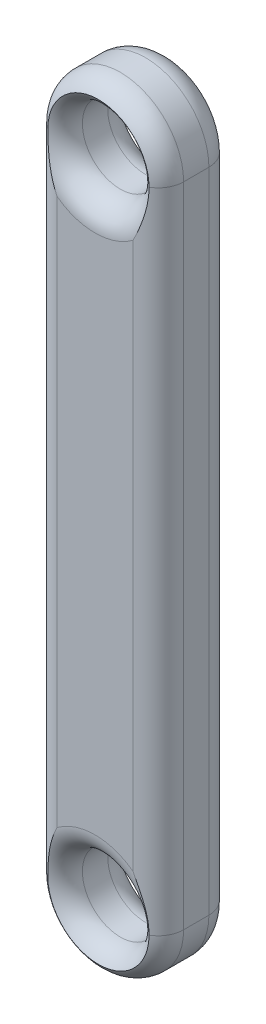
from build123d import *

# Parameters (mm, degrees)
SKETCH1_R           = 1.5
BOSS_EXTRUDE1_DEPTH = 3
FILLET2_R           = 1


with BuildPart() as part:
    # Sketch1 → Boss-Extrude1 (new body)
    with BuildSketch(Plane.XY):
        with BuildLine():
            Line((-2.5, 0), (-2.5, 25.6))
            ThreePointArc((-2.5, 25.6), (0, 28.1), (2.5, 25.6))
            Line((2.5, 25.6), (2.5, 0))
            ThreePointArc((2.5, 0), (0, -2.5), (-2.5, 0))
        make_face()
        with Locations((0, 25.6)):
            Circle(SKETCH1_R, mode=Mode.SUBTRACT)
        Circle(SKETCH1_R, mode=Mode.SUBTRACT)
    extrude(amount=BOSS_EXTRUDE1_DEPTH)

    # Fillet2
    # the kernel refuses this fillet: 1 mm, written as the material it takes off along each edge
    with BuildSketch(Plane(origin=(0, 0, 3), x_dir=(1, 0, 0), z_dir=(0, 1, 0))) as fillet2_piece_1:
        with BuildLine():
            CenterArc((2.5 - FILLET2_R, FILLET2_R), FILLET2_R, 270, 90)
            Line((2.5 - FILLET2_R, 0), (2.5, 0))
            Line((2.5, 0), (2.5, FILLET2_R))
        make_face()
    revolve(axis=Axis((0, 0, 3), (0, 0, -1)), revolution_arc=180, mode=Mode.SUBTRACT)
    with BuildSketch(Plane(origin=(0, 0, 0), x_dir=(1, 0, 0), z_dir=(0, 1, 0))) as fillet2_piece_2:
        with BuildLine():
            CenterArc((2.5 - FILLET2_R, -FILLET2_R), FILLET2_R, 0, 90)
            Line((2.5 - FILLET2_R, 0), (2.5, 0))
            Line((2.5, 0), (2.5, -FILLET2_R))
        make_face()
    revolve(axis=Axis((0, 0, 0), (0, 0, -1)), revolution_arc=180, mode=Mode.SUBTRACT)
    with BuildSketch(Plane(origin=(2.5, 25.6, 3), x_dir=(0, 0, -1), z_dir=(0, -1, 0)), Plane(origin=(-2.5, 0, 3), x_dir=(0, 0, -1), z_dir=(0, 1, 0))) as fillet2_piece_3:
        with BuildLine():
            CenterArc((FILLET2_R, -FILLET2_R), FILLET2_R, 90, 90)
            Line((0, -FILLET2_R), (0, 0))
            Line((0, 0), (FILLET2_R, 0))
        make_face()
    extrude(amount=25.6, mode=Mode.SUBTRACT)
    with BuildSketch(Plane(origin=(2.5, 25.6, 0), x_dir=(0, 0, 1), z_dir=(0, -1, 0)), Plane(origin=(-2.5, 0, 0), x_dir=(0, 0, 1), z_dir=(0, 1, 0))) as fillet2_piece_4:
        with BuildLine():
            CenterArc((FILLET2_R, FILLET2_R), FILLET2_R, 180, 90)
            Line((0, FILLET2_R), (0, 0))
            Line((0, 0), (FILLET2_R, 0))
        make_face()
    extrude(amount=25.6, mode=Mode.SUBTRACT)
    with BuildSketch(Plane(origin=(0, 25.6, 3), x_dir=(-1, 0, 0), z_dir=(0, -1, 0))) as fillet2_piece_5:
        with BuildLine():
            CenterArc((2.5 - FILLET2_R, FILLET2_R), FILLET2_R, 270, 90)
            Line((2.5 - FILLET2_R, 0), (2.5, 0))
            Line((2.5, 0), (2.5, FILLET2_R))
        make_face()
    revolve(axis=Axis((0, 25.6, 3), (0, 0, -1)), revolution_arc=180, mode=Mode.SUBTRACT)
    with BuildSketch(Plane(origin=(0, 25.6, 0), x_dir=(-1, 0, 0), z_dir=(0, -1, 0))) as fillet2_piece_6:
        with BuildLine():
            CenterArc((2.5 - FILLET2_R, -FILLET2_R), FILLET2_R, 0, 90)
            Line((2.5 - FILLET2_R, 0), (2.5, 0))
            Line((2.5, 0), (2.5, -FILLET2_R))
        make_face()
    revolve(axis=Axis((0, 25.6, 0), (0, 0, -1)), revolution_arc=180, mode=Mode.SUBTRACT)
    with BuildSketch(Plane(origin=(0, 25.6, 0), x_dir=(1, 0, 0), z_dir=(0, -1, 0))) as fillet2_piece_7:
        with BuildLine():
            CenterArc((1.5 + FILLET2_R, FILLET2_R), FILLET2_R, 180, 90)
            Line((1.5 + FILLET2_R, 0), (1.5, 0))
            Line((1.5, 0), (1.5, FILLET2_R))
        make_face()
    revolve(axis=Axis((0, 25.6, 0), (0, 0, 1)), mode=Mode.SUBTRACT)
    with BuildSketch(Plane(origin=(0, 25.6, 3), x_dir=(1, 0, 0), z_dir=(0, -1, 0))) as fillet2_piece_8:
        with BuildLine():
            CenterArc((1.5 + FILLET2_R, -FILLET2_R), FILLET2_R, 90, 90)
            Line((1.5 + FILLET2_R, 0), (1.5, 0))
            Line((1.5, 0), (1.5, -FILLET2_R))
        make_face()
    revolve(axis=Axis((0, 25.6, 3), (0, 0, 1)), mode=Mode.SUBTRACT)
    with BuildSketch(Plane(origin=(0, 0, 0), x_dir=(1, 0, 0), z_dir=(0, -1, 0))) as fillet2_piece_9:
        with BuildLine():
            CenterArc((1.5 + FILLET2_R, FILLET2_R), FILLET2_R, 180, 90)
            Line((1.5 + FILLET2_R, 0), (1.5, 0))
            Line((1.5, 0), (1.5, FILLET2_R))
        make_face()
    revolve(axis=Axis((0, 0, 0), (0, 0, 1)), mode=Mode.SUBTRACT)
    with BuildSketch(Plane(origin=(0, 0, 3), x_dir=(1, 0, 0), z_dir=(0, -1, 0))) as fillet2_piece_10:
        with BuildLine():
            CenterArc((1.5 + FILLET2_R, -FILLET2_R), FILLET2_R, 90, 90)
            Line((1.5 + FILLET2_R, 0), (1.5, 0))
            Line((1.5, 0), (1.5, -FILLET2_R))
        make_face()
    revolve(axis=Axis((0, 0, 3), (0, 0, 1)), mode=Mode.SUBTRACT)


solid = part.part
